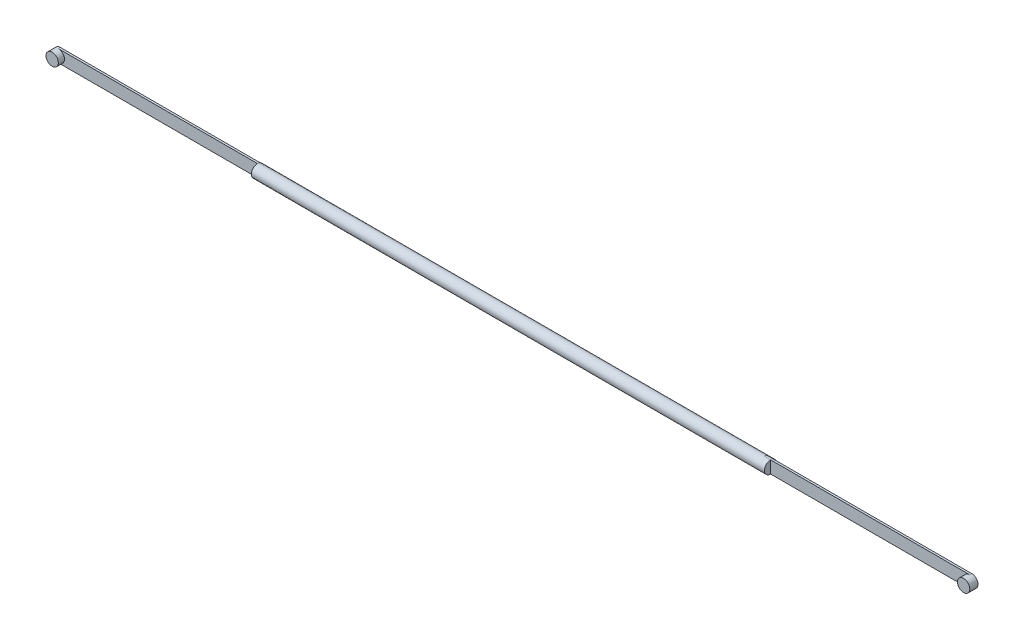
from build123d import *

# Parameters (mm, degrees)
SKETCH8_W               = 97
SKETCH8_H               = 6
SKETCH8_W_2             = 100
BOSS_EXTRUDE1_DEPTH     = 1
CUT_EXTRUDE2_DEPTH      = 223.056299168
CUT_EXTRUDE2_DEPTH_BACK = 223.056299168
SKETCH20_R              = 3
SKETCH20_3_R            = 3
BOSS_EXTRUDE2_DEPTH     = 4


# Read off the part's stored shape, not the designer's step: Cut-Revolve4
with BuildPart() as part:
    # Sketch1 → Revolve2 (revolve)
    with BuildSketch(Plane.XY, mode=Mode.PRIVATE) as revolve2_sk:
        Polygon((-125, 0), (125, 0), (125, 3), (0, 3), (-125, 3), align=None)
    revolve(revolve2_sk.sketch.rotate(Axis((-125, 0, 0), (1, 0, 0)), 180), axis=Axis((-125, 0, 0), (1, 0, 0)))

    # Sketch8 → Boss-Extrude1 (add)
    with BuildSketch(Plane.XY):
        with Locations((-173.5, 0)):
            Rectangle(SKETCH8_W, SKETCH8_H)
        with Locations((172, 0)):
            Rectangle(SKETCH8_W_2, SKETCH8_H)
    extrude(amount=-BOSS_EXTRUDE1_DEPTH)

    # Sketch20 → Cut-Extrude2 (cut, two sides: drawn at the far end of the back side and taken through both)
    with BuildSketch(Plane(origin=(0, 0, -1), x_dir=(-1, 0, 0), z_dir=(0, 0, -1)).offset(-CUT_EXTRUDE2_DEPTH_BACK)):
        with Locations((222, 0)):
            Circle(SKETCH20_R)
        with Locations((-222, 0)):
            Circle(SKETCH20_R)
    extrude(amount=CUT_EXTRUDE2_DEPTH + CUT_EXTRUDE2_DEPTH_BACK, mode=Mode.SUBTRACT)

    # Sketch20<3> → Boss-Extrude2 (add, symmetric)
    with BuildSketch(Plane(origin=(0, 0, -1), x_dir=(-1, 0, 0), z_dir=(0, 0, -1))):
        with Locations((222, 0)):
            Circle(SKETCH20_3_R)
    boss_extrude2 = extrude(amount=BOSS_EXTRUDE2_DEPTH, both=True)

    # Sketch22 → Cut-Revolve3 (revolve, cut)
    with BuildSketch(Plane(origin=(0, 0, -1), x_dir=(-1, 0, 0), z_dir=(0, 0, -1))):
        with BuildLine():
            Line((222, 3), (222, -3))
            ThreePointArc((222, -3), (225, 0), (222, 3))
        make_face()
    revolve(axis=Axis((-222, 3, -1), (0, -1, 0)), mode=Mode.SUBTRACT)


with BuildPart() as cut_revolve3_kept_piece:
    # of the separate pieces the step leaves, the one the design keeps (cut_revolve3_pieces_kept)
    add(part.part.solids().sort_by_distance((-225, 0, 3))[0])

    # Mirror3: Boss-Extrude2 across plane
    add(boss_extrude2.mirror(Plane(origin=(0, 0, 0), x_dir=(0, 0, 1), z_dir=(1, 0, 0))))

    # Cut-Revolve4 outline → Cut-Revolve4 (revolve, cut)
    with BuildSketch(Plane(origin=(222, 0, 0), x_dir=(1, 0, 0), z_dir=(0, -1, 0))):
        with BuildLine():
            Line((0, 2), (0, -5))
            Line((0, -5), (3, -5))
            Line((3, -5), (3, -1.000000003))
            ThreePointArc((3, -1.000000003), (2.121320345, 1.121320342), (0, 2))
        make_face()
    revolve(axis=Axis((222, 0, 0), (0, 0, 1)), mode=Mode.SUBTRACT)


solid = cut_revolve3_kept_piece.part
